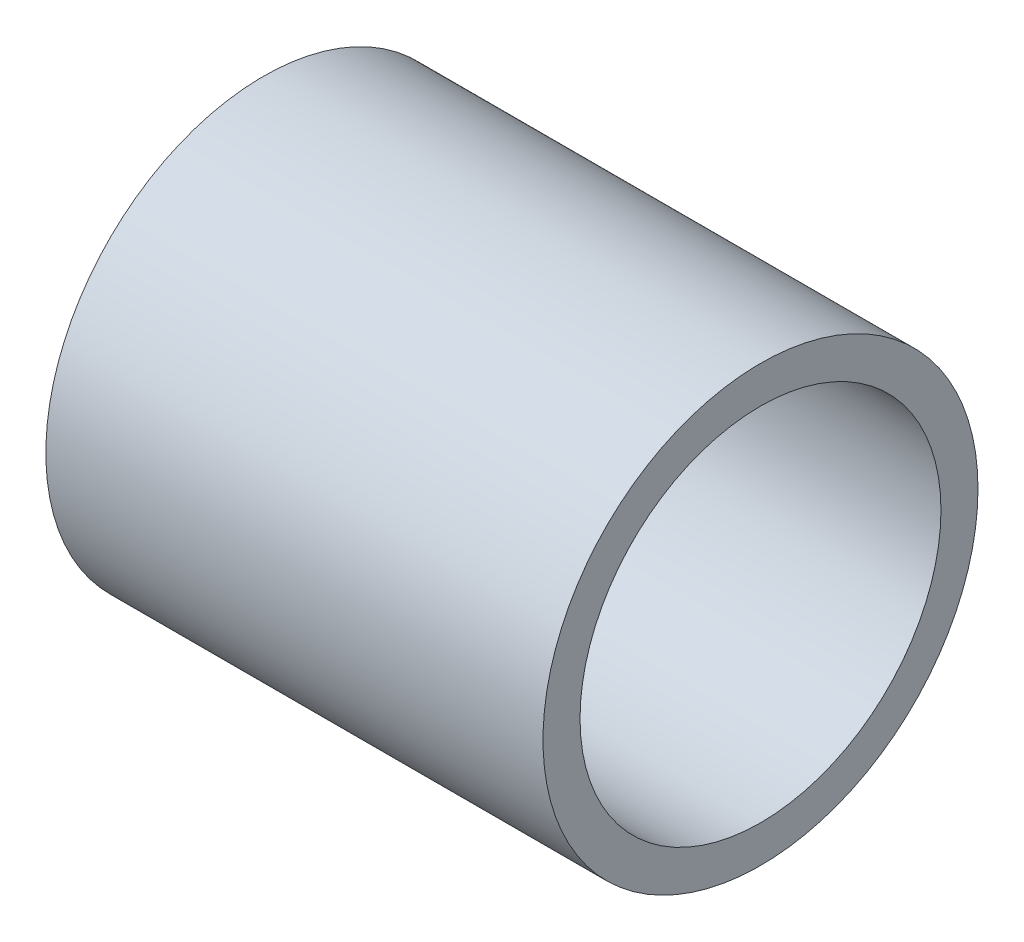
from build123d import *

# Parameters (mm, degrees)
SKETCH1_R           = 11.1125
SKETCH1_R_2         = 9.2202
BOSS_EXTRUDE1_DEPTH = 25.4


with BuildPart() as part:
    # Sketch1 → Boss-Extrude1 (new body)
    with BuildSketch(Plane(origin=(0, 0, 0), x_dir=(0, 0, -1), z_dir=(1, 0, 0))):
        Circle(SKETCH1_R)
        Circle(SKETCH1_R_2, mode=Mode.SUBTRACT)
    extrude(amount=BOSS_EXTRUDE1_DEPTH)


solid = part.part
